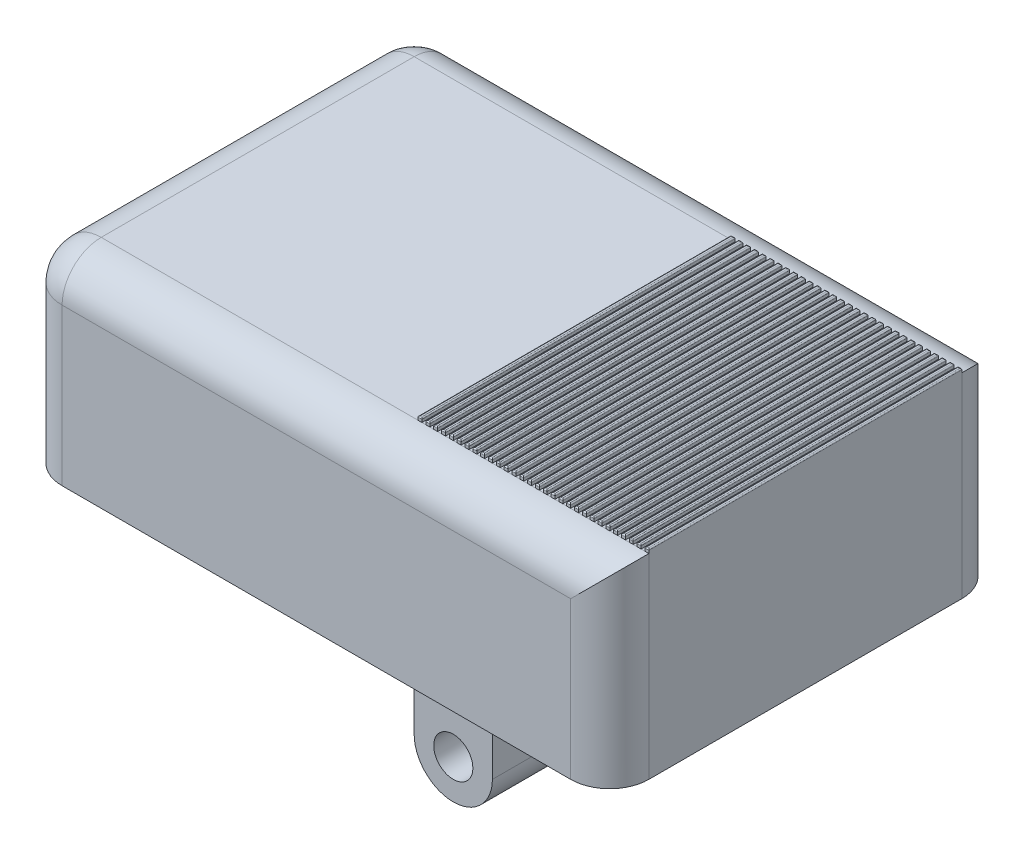
from build123d import *

# Parameters (mm, degrees)
SKETCH2_W           = 75
SKETCH2_H           = 50
BOSS_EXTRUDE1_DEPTH = 25
SKETCH3_W           = 10
SKETCH3_H           = 10
BOSS_EXTRUDE2_DEPTH = 15
FILLET1_R           = 5
SKETCH4_R           = 2.5
CUT_EXTRUDE1_DEPTH  = 64.688696014
SKETCH5_R           = 2.75
CUT_EXTRUDE2_DEPTH  = 5
SKETCH6_R           = 2.125
BOSS_EXTRUDE3_DEPTH = 10
BOSS_EXTRUDE4_START = 0.75
BOSS_EXTRUDE4_DEPTH = 0.75
FILLET2_R           = 5
SKETCH8_W           = 0.5
SKETCH8_H           = 40
BOSS_EXTRUDE5_DEPTH = 0.5
FILLET3_R           = 0.15
SKETCH9_W           = 5
SKETCH9_H           = 15
BOSS_EXTRUDE6_DEPTH = 8
FILLET4_R           = 2
SKETCH10_R          = 4
CUT_EXTRUDE3_DEPTH  = 10
FILLET5_R           = 2


# Some blends are built 0.0001 mm under size
with BuildPart() as part:
    # Sketch2 → Boss-Extrude1 (new body)
    with BuildSketch(Plane(origin=(0, 0, 0), x_dir=(1, 0, 0), z_dir=(0, 1, 0))):
        Rectangle(SKETCH2_W, SKETCH2_H)
    extrude(amount=BOSS_EXTRUDE1_DEPTH)

    # Sketch3 → Boss-Extrude2 (add)
    with BuildSketch(Plane.XZ):
        with Locations((12.5, -15)):
            Rectangle(SKETCH3_W, SKETCH3_H)
        with Locations((12.5, 15)):
            Rectangle(SKETCH3_W, SKETCH3_H)
    extrude(amount=BOSS_EXTRUDE2_DEPTH)

    # Fillet1
    fillet1_edges = [part.edges().sort_by_distance(p)[0] for p in [
        (17.5, -15, -15),
        (7.5, -15, -15),
        (17.5, -15, 15),
        (7.5, -15, 15),
    ]]
    fillet(fillet1_edges, radius=FILLET1_R - 0.0001)  # a hair under: the kernel refuses the full size

    # Sketch4 → Cut-Extrude1 (cut, through all)
    with BuildSketch(Plane.XY.offset(20)):
        with Locations((12.5, -10)):
            Circle(SKETCH4_R)
    extrude(amount=-CUT_EXTRUDE1_DEPTH, mode=Mode.SUBTRACT)

    # Sketch5 → Cut-Extrude2 (cut)
    with BuildSketch(Plane.XZ):
        with Locations(Location((27.5, 0, 0), (0, 0, 270))):
            Circle(SKETCH5_R)
    extrude(amount=-CUT_EXTRUDE2_DEPTH, mode=Mode.SUBTRACT)

    # Sketch6 → Boss-Extrude3 (add)
    with BuildSketch(Plane.XZ.offset(-5)):
        with Locations(Location((27.5, 0, 0), (0, 0, 270))):
            Circle(SKETCH6_R)
    extrude(amount=BOSS_EXTRUDE3_DEPTH)

    # Sketch7 → Boss-Extrude4 (add)
    with BuildSketch(Plane(origin=(0, 2, 0), x_dir=(-1, 0, 0), z_dir=(0, -1, 0)).offset(BOSS_EXTRUDE4_START)):
        with BuildLine():
            Line((-29.88156986, -1.375), (-29.448557159, -1.125))
            ThreePointArc((-29.448557159, -1.125), (-29.75, 0), (-29.448557159, 1.125))
            Line((-29.448557159, 1.125), (-29.88156986, 1.375))
            ThreePointArc((-29.88156986, 1.375), (-30.25, 0), (-29.88156986, -1.375))
        make_face()
        with BuildLine():
            Line((-25.11843014, 1.375), (-25.551442841, 1.125))
            ThreePointArc((-25.551442841, 1.125), (-25.326666891, 0.582342851), (-25.25, 0))
            ThreePointArc((-25.25, 0), (-25.326666891, -0.582342851), (-25.551442841, -1.125))
            Line((-25.551442841, -1.125), (-25.11843014, -1.375))
            ThreePointArc((-25.11843014, -1.375), (-24.843703978, -0.711752374), (-24.75, 0))
            ThreePointArc((-24.75, 0), (-24.843703978, 0.711752374), (-25.11843014, 1.375))
        make_face()
    extrude(amount=-BOSS_EXTRUDE4_DEPTH)

    # Fillet2
    fillet2_edges = [part.edges().sort_by_distance(p)[0] for p in [
        (-37.5, 25, 0),
        (0, 25, 25),
        (37.5, 12.5, 25),
        (-37.5, 12.5, 25),
        (-37.5, 12.5, -25),
        (37.5, 12.5, -25),
        (0, 25, -25),
    ]]
    fillet(fillet2_edges, radius=FILLET2_R)

    # Sketch8 → Boss-Extrude5 (add)
    with BuildSketch(Plane(origin=(0, 25, 0), x_dir=(1, 0, 0), z_dir=(0, 1, 0))):
        with Locations((37.25, 0)):
            Rectangle(SKETCH8_W, SKETCH8_H)
        with Locations((36.25, 0)):
            Rectangle(SKETCH8_W, SKETCH8_H)
        with Locations((35.25, 0)):
            Rectangle(SKETCH8_W, SKETCH8_H)
        with Locations((34.25, 0)):
            Rectangle(SKETCH8_W, SKETCH8_H)
        with Locations((33.25, 0)):
            Rectangle(SKETCH8_W, SKETCH8_H)
        with Locations((32.25, 0)):
            Rectangle(SKETCH8_W, SKETCH8_H)
        with Locations((31.25, 0)):
            Rectangle(SKETCH8_W, SKETCH8_H)
        with Locations((30.25, 0)):
            Rectangle(SKETCH8_W, SKETCH8_H)
        with Locations((29.25, 0)):
            Rectangle(SKETCH8_W, SKETCH8_H)
        with Locations((28.25, 0)):
            Rectangle(SKETCH8_W, SKETCH8_H)
        with Locations((27.25, 0)):
            Rectangle(SKETCH8_W, SKETCH8_H)
        with Locations((26.25, 0)):
            Rectangle(SKETCH8_W, SKETCH8_H)
        with Locations((25.25, 0)):
            Rectangle(SKETCH8_W, SKETCH8_H)
        with Locations((24.25, 0)):
            Rectangle(SKETCH8_W, SKETCH8_H)
        with Locations((23.25, 0)):
            Rectangle(SKETCH8_W, SKETCH8_H)
        with Locations((22.25, 0)):
            Rectangle(SKETCH8_W, SKETCH8_H)
        with Locations((21.25, 0)):
            Rectangle(SKETCH8_W, SKETCH8_H)
        with Locations((20.25, 0)):
            Rectangle(SKETCH8_W, SKETCH8_H)
        with Locations((19.25, 0)):
            Rectangle(SKETCH8_W, SKETCH8_H)
        with Locations((18.25, 0)):
            Rectangle(SKETCH8_W, SKETCH8_H)
        with Locations((17.25, 0)):
            Rectangle(SKETCH8_W, SKETCH8_H)
        with Locations((16.25, 0)):
            Rectangle(SKETCH8_W, SKETCH8_H)
        with Locations((15.25, 0)):
            Rectangle(SKETCH8_W, SKETCH8_H)
        with Locations((14.25, 0)):
            Rectangle(SKETCH8_W, SKETCH8_H)
        with Locations((13.25, 0)):
            Rectangle(SKETCH8_W, SKETCH8_H)
        with Locations((12.25, 0)):
            Rectangle(SKETCH8_W, SKETCH8_H)
        with Locations((11.25, 0)):
            Rectangle(SKETCH8_W, SKETCH8_H)
        with Locations((10.25, 0)):
            Rectangle(SKETCH8_W, SKETCH8_H)
        with Locations((9.25, 0)):
            Rectangle(SKETCH8_W, SKETCH8_H)
        with Locations((8.25, 0)):
            Rectangle(SKETCH8_W, SKETCH8_H)
    extrude(amount=BOSS_EXTRUDE5_DEPTH)

    # Fillet3
    fillet3_edges = [part.edges().sort_by_distance(p)[0] for p in [
        (37.5, 25.5, 0),
        (37.25, 25.5, -20),
        (37, 25.5, 0),
        (37.25, 25.5, 20),
        (36.25, 25.5, 20),
        (36.5, 25.5, 0),
        (36.25, 25.5, -20),
        (36, 25.5, 0),
        (35.25, 25.5, 20),
        (35.5, 25.5, 0),
        (35.25, 25.5, -20),
        (35, 25.5, 0),
        (34.25, 25.5, 20),
        (34.5, 25.5, 0),
        (34.25, 25.5, -20),
        (34, 25.5, 0),
        (33.25, 25.5, 20),
        (33.5, 25.5, 0),
        (33.25, 25.5, -20),
        (33, 25.5, 0),
        (32.25, 25.5, 20),
        (32.5, 25.5, 0),
        (32.25, 25.5, -20),
        (32, 25.5, 0),
        (31.25, 25.5, 20),
        (31.5, 25.5, 0),
        (31.25, 25.5, -20),
        (31, 25.5, 0),
        (30.25, 25.5, 20),
        (30.5, 25.5, 0),
        (30.25, 25.5, -20),
        (30, 25.5, 0),
        (29.25, 25.5, 20),
        (29.5, 25.5, 0),
        (29.25, 25.5, -20),
        (29, 25.5, 0),
        (28.25, 25.5, 20),
        (28.5, 25.5, 0),
        (28.25, 25.5, -20),
        (28, 25.5, 0),
        (27.25, 25.5, 20),
        (27.5, 25.5, 0),
        (27.25, 25.5, -20),
        (27, 25.5, 0),
        (26.25, 25.5, 20),
        (26.5, 25.5, 0),
        (26.25, 25.5, -20),
        (26, 25.5, 0),
        (25.25, 25.5, 20),
        (25.5, 25.5, 0),
        (25.25, 25.5, -20),
        (25, 25.5, 0),
        (24.25, 25.5, 20),
        (24.5, 25.5, 0),
        (24.25, 25.5, -20),
        (24, 25.5, 0),
        (23.25, 25.5, 20),
        (23.5, 25.5, 0),
        (23.25, 25.5, -20),
        (23, 25.5, 0),
        (22.25, 25.5, 20),
        (22.5, 25.5, 0),
        (22.25, 25.5, -20),
        (22, 25.5, 0),
        (21.25, 25.5, 20),
        (21.5, 25.5, 0),
        (21.25, 25.5, -20),
        (21, 25.5, 0),
        (20.25, 25.5, 20),
        (20.5, 25.5, 0),
        (20.25, 25.5, -20),
        (20, 25.5, 0),
        (19.25, 25.5, 20),
        (19.5, 25.5, 0),
        (19.25, 25.5, -20),
        (19, 25.5, 0),
        (18.25, 25.5, 20),
        (18.5, 25.5, 0),
        (18.25, 25.5, -20),
        (18, 25.5, 0),
        (17.25, 25.5, 20),
        (17.5, 25.5, 0),
        (17.25, 25.5, -20),
        (17, 25.5, 0),
        (16.25, 25.5, 20),
        (16.5, 25.5, 0),
        (16.25, 25.5, -20),
        (16, 25.5, 0),
        (15.25, 25.5, 20),
        (15.5, 25.5, 0),
        (15.25, 25.5, -20),
        (15, 25.5, 0),
        (14.25, 25.5, 20),
        (14.5, 25.5, 0),
        (14.25, 25.5, -20),
        (14, 25.5, 0),
        (13.25, 25.5, 20),
        (13.5, 25.5, 0),
        (13.25, 25.5, -20),
        (13, 25.5, 0),
        (12.25, 25.5, 20),
        (12.5, 25.5, 0),
        (12.25, 25.5, -20),
        (12, 25.5, 0),
        (11.25, 25.5, 20),
        (11.5, 25.5, 0),
        (11.25, 25.5, -20),
        (11, 25.5, 0),
        (10.25, 25.5, 20),
        (10.5, 25.5, 0),
        (10.25, 25.5, -20),
        (10, 25.5, 0),
        (9.25, 25.5, 20),
        (9.5, 25.5, 0),
        (9.25, 25.5, -20),
        (9, 25.5, 0),
        (8.25, 25.5, 20),
        (8.5, 25.5, 0),
        (8.25, 25.5, -20),
        (8, 25.5, 0),
    ]]
    fillet(fillet3_edges, radius=FILLET3_R)

    # Sketch9 → Boss-Extrude6 (add)
    with BuildSketch(Plane.XZ):
        with Locations((-23, 0)):
            Rectangle(SKETCH9_W, SKETCH9_H)
    extrude(amount=BOSS_EXTRUDE6_DEPTH)

    # Fillet4
    fillet4_edges = [part.edges().sort_by_distance(p)[0] for p in [
        (-20.5, -4, -7.5),
        (-20.5, -4, 7.5),
        (-25.5, -4, 7.5),
        (-25.5, -4, -7.5),
        (-23, -8, 7.5),
        (-23, -8, -7.5),
    ]]
    fillet(fillet4_edges, radius=FILLET4_R)

    # Sketch10 → Cut-Extrude3 (cut)
    with BuildSketch(Plane.ZY.offset(25.5)):
        with Locations((0, -8)):
            Circle(SKETCH10_R)
    extrude(amount=-CUT_EXTRUDE3_DEPTH, mode=Mode.SUBTRACT)

    # Fillet5
    # the kernel refuses this fillet: 2 mm, written as the material it takes off along each edge
    with BuildSketch(Plane(origin=(-29.25, -8, 4), x_dir=(0, 0.9856931110091562, -0.1685499656158108), z_dir=(1, 0, 0))) as fillet5_piece_1:
        with BuildLine():
            CenterArc((1.685499656, 1.971386222), FILLET5_R, 194.265960627, 66.030517682)
            Line((-0.252824948, 1.478539667), (-0.291591441, 1.468682735))
            ThreePointArc((-0.291591441, 1.468682735), (-0.165840199, 0.732527835), (-0.039427724, -0.006741999))
            Line((-0.039427724, -0.006741999), (0.006741999, -0.039427724))
            ThreePointArc((0.006741999, -0.039427724), (0.674199862, 0.017227556), (1.341657726, -0.039427724))
            Line((1.341657726, -0.039427724), (1.348399725, 0))
        make_face()
    extrude(amount=12.5, mode=Mode.SUBTRACT)
    with BuildSketch(Plane(origin=(-16.75, -8, -4), x_dir=(0, 0, -1), z_dir=(-1, 0, 0))) as fillet5_piece_2:
        with BuildLine():
            CenterArc((1.659090909, -1.99366248), FILLET5_R, 94.562438935, 66.030517682)
            Line((-0.227272727, -1.32910832), (-0.265, -1.315817237))
            ThreePointArc((-0.265, -1.315817237), (-0.09665528, -0.667457864), (-0.04, 0))
            Line((-0.04, 0), (0, 0.04))
            ThreePointArc((0, 0.04), (0.75, 0.04), (1.496818182, 0.03987325))
            Line((1.496818182, 0.03987325), (1.5, 0))
        make_face()
    extrude(amount=12.5, mode=Mode.SUBTRACT)


solid = part.part
